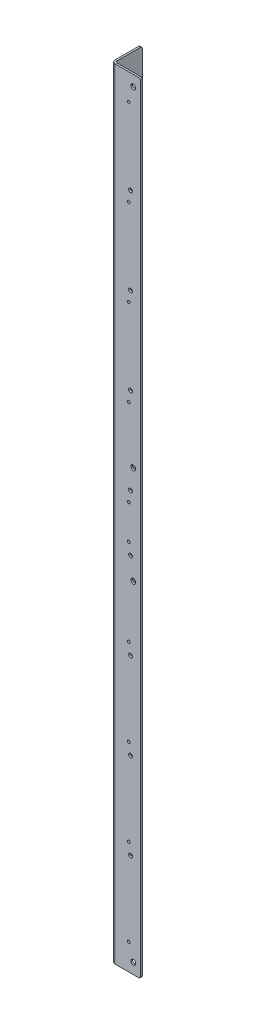
from build123d import *

# Parameters (mm, degrees)
BASE_FLANGE1_DEPTH               = 1371.6
F_17_64_0_26563_DIAMETER_HOLE1_D = 6.747002
SKETCH8_W                        = 28.575
SKETCH8_H                        = 69.85
CUT_EXTRUDE1_DEPTH               = 1374.480192795
F_10_0_1935_DIAMETER_HOLE1_D     = 4.9149
F_17_64_0_26563_DIAMETER_HOLE2_D = 6.747002
F_11_32_0_34375_DIAMETER_HOLE1_D = 8.73125
FILLET1_R                        = 3.175
CUT_EXTRUDE2_DEPTH               = 1374.480192795


# Sheet-metal steps are written as plain solids
with BuildPart() as part:
    # Sketch1 → Base-Flange1 (new body)
    with BuildSketch(Plane(origin=(0, 0, 0), x_dir=(1, 0, 0), z_dir=(0, 1, 0))):
        with BuildLine():
            Line((0, 50.8), (0, 6.35))
            ThreePointArc((0, 6.35), (1.859871939, 1.859871939), (6.35, 0))
            Line((6.35, 0), (50.8, 0))
            Line((50.8, 0), (50.8, 3.175))
            Line((50.8, 3.175), (6.35, 3.175))
            ThreePointArc((6.35, 3.175), (4.10493597, 4.10493597), (3.175, 6.35))
            Line((3.175, 6.35), (3.175, 50.8))
            Line((3.175, 50.8), (0, 50.8))
        make_face()
    extrude(amount=BASE_FLANGE1_DEPTH)

    # 17/64 (0.26563) Diameter Hole1 (through all)
    with Locations(Plane.ZY):
        with Locations((-38.1, 50.8), (-38.1, 685.8), (-38.1, 1320.8)):
            Hole(F_17_64_0_26563_DIAMETER_HOLE1_D / 2)

    # Sketch8 → Cut-Extrude1 (cut, through all)
    with BuildSketch(Plane.ZY):
        with Locations((-36.5125, 428.625)):
            Rectangle(SKETCH8_W, SKETCH8_H)
        with Locations((-36.5125, 942.975)):
            Rectangle(SKETCH8_W, SKETCH8_H)
    extrude(amount=-CUT_EXTRUDE1_DEPTH, mode=Mode.SUBTRACT)

    # #10 (0.1935) Diameter Hole1 (through all)
    with Locations(Plane.XY):
        with Locations((30.1625, 46.0375), (30.1625, 198.4375), (30.1625, 350.8375), (30.1625, 503.2375), (30.1625, 655.6375)):
            f_10_0_1935_diameter_hole1 = Hole(F_10_0_1935_DIAMETER_HOLE1_D / 2)

    # 17/64 (0.26563) Diameter Hole2 (through all)
    with Locations(Plane.XY):
        with Locations((33.3375, 179.1335), (33.3375, 331.5335), (33.3375, 483.9335), (33.3375, 636.3335)):
            f_17_64_0_26563_diameter_hole2 = Hole(F_17_64_0_26563_DIAMETER_HOLE2_D / 2)

    # 11/32 (0.34375) Diameter Hole1 (through all)
    with Locations(Plane.XY):
        with Locations((38.1, 1352.55), (38.1, 772.16)):
            f_11_32_0_34375_diameter_hole1 = Hole(F_11_32_0_34375_DIAMETER_HOLE1_D / 2)

    # Fillet1
    fillet1_edges = [part.edges().sort_by_distance(p)[0] for p in [
        (50.8, 1371.6, -1.5875),
        (1.5875, 393.7, -50.8),
        (1.5875, 463.55, -50.8),
        (1.5875, 463.55, -22.225),
        (1.5875, 393.7, -22.225),
        (1.5875, 908.05, -22.225),
        (1.5875, 908.05, -50.8),
        (1.5875, 977.9, -50.8),
        (1.5875, 977.9, -22.225),
        (50.8, 0, -1.5875),
        (1.5875, 1371.6, -50.8),
        (1.5875, 0, -50.8),
    ]]
    fillet(fillet1_edges, radius=FILLET1_R)

    # Mirror1: #10 (0.1935) Diameter Hole1, 17/64 (0.26563) Diameter Hole2, 11/32 (0.34375) Diameter Hole1 across plane
    add(f_10_0_1935_diameter_hole1.mirror(Plane.ZX.offset(685.8)), mode=Mode.SUBTRACT)
    add(f_17_64_0_26563_diameter_hole2.mirror(Plane.ZX.offset(685.8)), mode=Mode.SUBTRACT)
    add(f_11_32_0_34375_diameter_hole1.mirror(Plane.ZX.offset(685.8)), mode=Mode.SUBTRACT)

    # Sketch15 → Cut-Extrude2 (cut, through all)
    with BuildSketch(Plane.ZY):
        with BuildLine():
            Line((-41.4734375, 1314.45), (-41.4734375, 1327.15))
            ThreePointArc((-41.4734375, 1327.15), (-38.1, 1330.5234375), (-34.7265625, 1327.15))
            Line((-34.7265625, 1327.15), (-34.7265625, 1314.45))
            ThreePointArc((-34.7265625, 1314.45), (-38.1, 1311.0765625), (-41.4734375, 1314.45))
        make_face()
        with BuildLine():
            Line((-41.4734375, 679.45), (-41.4734375, 692.15))
            ThreePointArc((-41.4734375, 692.15), (-38.1, 695.5234375), (-34.7265625, 692.15))
            Line((-34.7265625, 692.15), (-34.7265625, 679.45))
            ThreePointArc((-34.7265625, 679.45), (-38.1, 676.0765625), (-41.4734375, 679.45))
        make_face()
        with BuildLine():
            Line((-41.4734375, 44.45), (-41.4734375, 57.15))
            ThreePointArc((-41.4734375, 57.15), (-38.1, 60.5234375), (-34.7265625, 57.15))
            Line((-34.7265625, 57.15), (-34.7265625, 44.45))
            ThreePointArc((-34.7265625, 44.45), (-38.1, 41.0765625), (-41.4734375, 44.45))
        make_face()
    extrude(amount=-CUT_EXTRUDE2_DEPTH, mode=Mode.SUBTRACT)


solid = part.part
